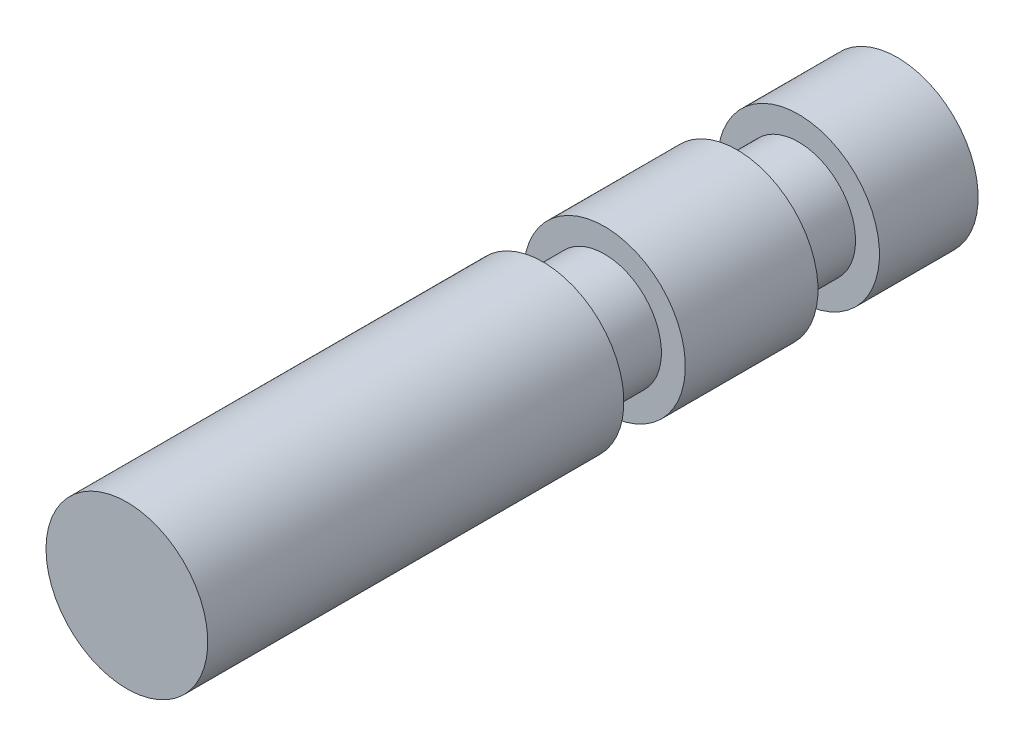
from build123d import *

# Parameters (mm, degrees)
SKETCH1_R           = 3.175
BOSS_EXTRUDE1_DEPTH = 30.2387
SKETCH9_R           = 1.397
CUT_EXTRUDE3_DEPTH  = 7.62
SKETCH4_W           = 2.413
SKETCH4_H           = 1.4224
LPATTERN1_COUNT     = 2
LPATTERN1_PITCH     = 7.62


with BuildPart() as part:
    # Sketch1 → Boss-Extrude1 (new body)
    with BuildSketch(Plane.XY):
        Circle(SKETCH1_R)
    extrude(amount=BOSS_EXTRUDE1_DEPTH)

    # Sketch9 → Cut-Extrude3 (cut)
    with BuildSketch(Plane(origin=(0, 0, 0), x_dir=(-1, 0, 0), z_dir=(0, 0, -1))):
        Circle(SKETCH9_R)
    extrude(amount=-CUT_EXTRUDE3_DEPTH, mode=Mode.SUBTRACT)

    # Sketch4 → Cut-Revolve1 (revolve, cut)
    with BuildSketch(Plane(origin=(0, 0, 0), x_dir=(0, 0, -1), z_dir=(1, 0, 0))):
        with Locations((-5.08, 2.9464)):
            Rectangle(SKETCH4_W, SKETCH4_H)
    cut_revolve1 = revolve(axis=Axis((0, 0, 0), (0, 0, 1)), mode=Mode.SUBTRACT)

    # LPattern1: Cut-Revolve1 ×2
    with Locations(*[(0, 0, i * LPATTERN1_PITCH) for i in range(1, LPATTERN1_COUNT)]):
        add(cut_revolve1, mode=Mode.SUBTRACT)


solid = part.part
